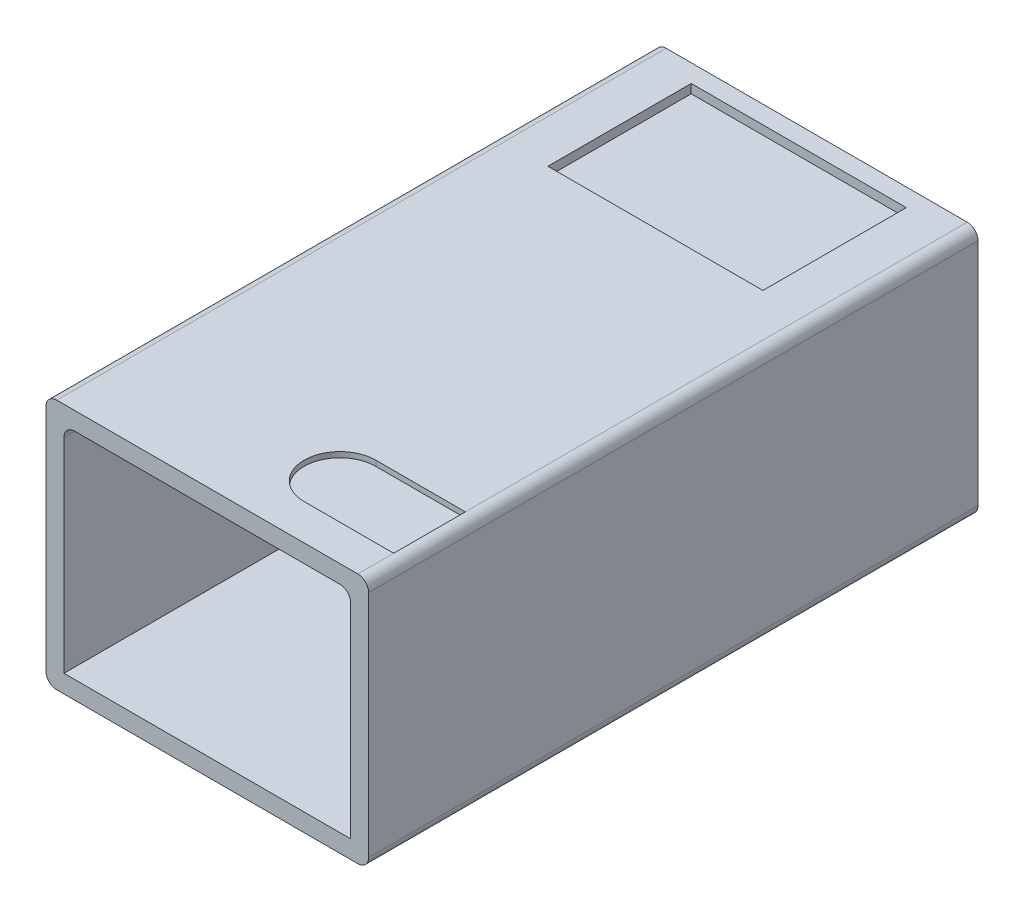
from build123d import *

# Parameters (mm, degrees)
BOSS_EXTRUDE1_DEPTH = 168
BOSS_EXTRUDE2_START = -2
BOSS_EXTRUDE2_DEPTH = 2
SKETCH2_W           = 60
SKETCH2_H           = 40
CUT_EXTRUDE1_DEPTH  = 2.5
CUT_EXTRUDE2_DEPTH  = 1.5


with BuildPart() as part:
    # Sketch1 → Boss-Extrude1 (new body)
    with BuildSketch(Plane.XY):
        with BuildLine():
            Line((-42, 35), (42, 35))
            ThreePointArc((42, 35), (44.121320344, 34.121320344), (45, 32))
            Line((45, 32), (45, -32))
            ThreePointArc((45, -32), (44.121320344, -34.121320344), (42, -35))
            Line((42, -35), (-42, -35))
            ThreePointArc((-42, -35), (-44.121320344, -34.121320344), (-45, -32))
            Line((-45, -32), (-45, 32))
            ThreePointArc((-45, 32), (-44.121320344, 34.121320344), (-42, 35))
        make_face()
        with BuildLine():
            Line((-37, 30), (37, 30))
            ThreePointArc((37, 30), (39.121320344, 29.121320344), (40, 27))
            Line((40, 27), (40, -30))
            Line((40, -30), (-40, -30))
            Line((-40, -30), (-40, 27))
            ThreePointArc((-40, 27), (-39.121320344, 29.121320344), (-37, 30))
        make_face(mode=Mode.SUBTRACT)
    extrude(amount=BOSS_EXTRUDE1_DEPTH)

    # Sketch1<2> → Boss-Extrude2 (add)
    with BuildSketch(Plane.XY.offset(BOSS_EXTRUDE2_START)):
        with BuildLine():
            Line((-42, 35), (42, 35))
            ThreePointArc((42, 35), (44.121320344, 34.121320344), (45, 32))
            Line((45, 32), (45, -32))
            ThreePointArc((45, -32), (44.121320344, -34.121320344), (42, -35))
            Line((42, -35), (-42, -35))
            ThreePointArc((-42, -35), (-44.121320344, -34.121320344), (-45, -32))
            Line((-45, -32), (-45, 32))
            ThreePointArc((-45, 32), (-44.121320344, 34.121320344), (-42, 35))
        make_face()
    extrude(amount=BOSS_EXTRUDE2_DEPTH)

    # Sketch2 → Cut-Extrude1 (cut)
    with BuildSketch(Plane(origin=(0, 35, 0), x_dir=(1, 0, 0), z_dir=(0, 1, 0))):
        with Locations((0, -23)):
            Rectangle(SKETCH2_W, SKETCH2_H)
    extrude(amount=-CUT_EXTRUDE1_DEPTH, mode=Mode.SUBTRACT)

    # Sketch2<3> → Cut-Extrude2 (cut)
    with BuildSketch(Plane(origin=(0, 35, 0), x_dir=(1, 0, 0), z_dir=(0, 1, 0))):
        with BuildLine():
            Line((42, -158), (17, -158))
            ThreePointArc((17, -158), (7, -148), (17, -138))
            Line((17, -138), (42, -138))
            Line((42, -138), (42, -158))
        make_face()
    extrude(amount=-CUT_EXTRUDE2_DEPTH, mode=Mode.SUBTRACT)


solid = part.part
